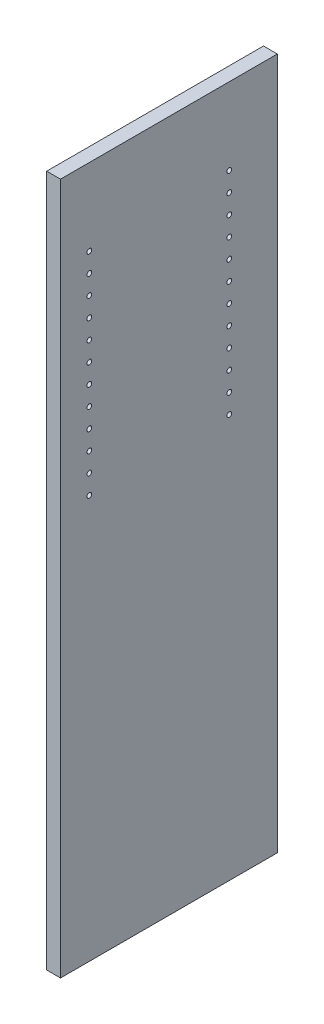
from build123d import *

# Parameters (mm, degrees)
SKETCH1_W           = 286.54375
SKETCH1_H           = 914.4
BOSS_EXTRUDE1_DEPTH = 18.25625
SKETCH3_R           = 3.175
CUT_EXTRUDE1_DEPTH  = 9.525


with BuildPart() as part:
    # Sketch1 → Boss-Extrude1 (new body)
    with BuildSketch(Plane(origin=(0, 0, 0), x_dir=(0, 0, -1), z_dir=(1, 0, 0))):
        Rectangle(SKETCH1_W, SKETCH1_H)
    extrude(amount=BOSS_EXTRUDE1_DEPTH)

    # Sketch3 → Cut-Extrude1 (cut)
    with BuildSketch(Plane(origin=(18.25625, 0, 0), x_dir=(0, 0, -1), z_dir=(1, 0, 0))):
        with Locations((-105.171875, 355.6)):
            Circle(SKETCH3_R)
        with Locations((-105.171875, 330.2)):
            Circle(SKETCH3_R)
        with Locations((-105.171875, 304.8)):
            Circle(SKETCH3_R)
        with Locations((-105.171875, 279.4)):
            Circle(SKETCH3_R)
        with Locations((-105.171875, 254)):
            Circle(SKETCH3_R)
        with Locations((-105.171875, 228.6)):
            Circle(SKETCH3_R)
        with Locations((-105.171875, 203.2)):
            Circle(SKETCH3_R)
        with Locations((-105.171875, 177.8)):
            Circle(SKETCH3_R)
        with Locations((-105.171875, 152.4)):
            Circle(SKETCH3_R)
        with Locations((-105.171875, 127)):
            Circle(SKETCH3_R)
        with Locations((-105.171875, 101.6)):
            Circle(SKETCH3_R)
        with Locations((-105.171875, 76.2)):
            Circle(SKETCH3_R)
        with Locations((79.771875, 76.2)):
            Circle(SKETCH3_R)
        with Locations((79.771875, 101.6)):
            Circle(SKETCH3_R)
        with Locations((79.771875, 127)):
            Circle(SKETCH3_R)
        with Locations((79.771875, 152.4)):
            Circle(SKETCH3_R)
        with Locations((79.771875, 177.8)):
            Circle(SKETCH3_R)
        with Locations((79.771875, 203.2)):
            Circle(SKETCH3_R)
        with Locations((79.771875, 228.6)):
            Circle(SKETCH3_R)
        with Locations((79.771875, 254)):
            Circle(SKETCH3_R)
        with Locations((79.771875, 279.4)):
            Circle(SKETCH3_R)
        with Locations((79.771875, 304.8)):
            Circle(SKETCH3_R)
        with Locations((79.771875, 330.2)):
            Circle(SKETCH3_R)
        with Locations((79.771875, 355.6)):
            Circle(SKETCH3_R)
    extrude(amount=-CUT_EXTRUDE1_DEPTH, mode=Mode.SUBTRACT)


solid = part.part
